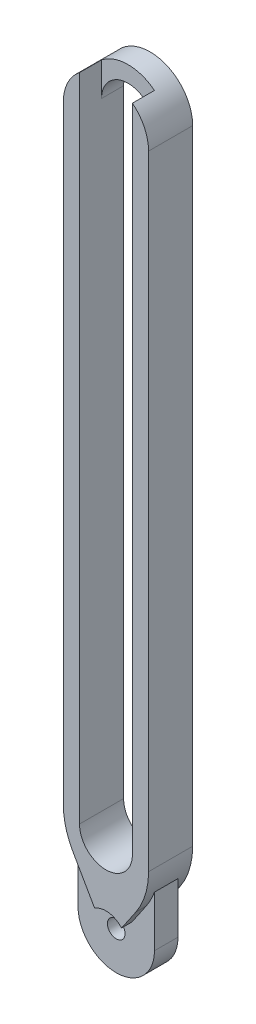
from build123d import *

# Parameters (mm, degrees)
ESTRUSIONE_ESTRUSIONE1_DEPTH = 7.5
ESTRUSIONE_ESTRUSIONE2_DEPTH = 4
TAGLIO_ESTRUSIONE1_DEPTH     = 198.380910943
TAGLIO_ESTRUSIONE2_DEPTH     = 198.380910943
RACCORDO1_R                  = 25
TAGLIO_ESTRUSIONE3_DEPTH     = 7.5
TAGLIO_ESTRUSIONE4_DEPTH     = 7.5
SCHIZZO6_R                   = 3
TAGLIO_ESTRUSIONE5_DEPTH     = 198.380910943


with BuildPart() as part:
    # Schizzo1 → Estrusione-Estrusione1 (new, symmetric)
    with BuildSketch(Plane.XY):
        with BuildLine():
            Line((14.5, 182.011383906), (14.5, -37.988616094))
            ThreePointArc((14.5, -37.988616094), (0, -52.488616094), (-14.5, -37.988616094))
            Line((-14.5, -37.988616094), (-14.5, 182.011383906))
            ThreePointArc((-14.5, 182.011383906), (0, 196.511383906), (14.5, 182.011383906))
        make_face()
    extrude(amount=ESTRUSIONE_ESTRUSIONE1_DEPTH, both=True)

    # Schizzo2 → Estrusione-Estrusione2 (add, symmetric)
    with BuildSketch(Plane.XY):
        with BuildLine():
            Line((13, -40.066616094), (13, -56.066616094))
            ThreePointArc((13, -56.066616094), (0, -69.066616094), (-13, -56.066616094))
            Line((-13, -56.066616094), (-13, -40.066616094))
            ThreePointArc((-13, -40.066616094), (0, -27.066616094), (13, -40.066616094))
        make_face()
    extrude(amount=ESTRUSIONE_ESTRUSIONE2_DEPTH, both=True)

    # Schizzo4 → Taglio-Estrusione1 (cut, through all)
    with BuildSketch(Plane.XY.offset(4)):
        with BuildLine():
            Line((5.29445937, -51.487456784), (14.5, -37.988616094))
            Line((14.5, -37.988616094), (21.494330869, -44.738036439))
            Line((21.494330869, -44.738036439), (5.386515672, -60.537124892))
            ThreePointArc((5.386515672, -60.537124892), (0.071202698, -63.066253954), (-5.29445937, -60.645775404))
            Line((-5.29445937, -60.645775404), (-28.596127717, -39.453615031))
            Line((-28.596127717, -39.453615031), (-14.5, -31.562211214))
            Line((-14.5, -31.562211214), (-3.845832517, -50.217721134))
            ThreePointArc((-3.845832517, -50.217721134), (0.963165144, -49.133196093), (5.29445937, -51.487456784))
        make_face()
    taglio_estrusione1 = extrude(amount=TAGLIO_ESTRUSIONE1_DEPTH, mode=Mode.SUBTRACT)

    # Specchia1: Taglio-Estrusione1 across plane
    add(taglio_estrusione1.mirror(Plane.XY), mode=Mode.SUBTRACT)

    # Schizzo5 → Taglio-Estrusione2 (cut, through all)
    with BuildSketch(Plane.XY.offset(4)):
        Polygon((-13, -44.411232383), (-13, -34.188720036), (-15.056335757, -30.588064032), (-15.056335757, -43.619366988), align=None)
        Polygon((13, -44.411232383), (13, -40.188189356), (17.407959402, -33.724436261), (17.407959402, -44.411232383), align=None)
    extrude(amount=-TAGLIO_ESTRUSIONE2_DEPTH, mode=Mode.SUBTRACT)

    # Raccordo1
    # the kernel refuses this fillet: 25 mm, written as the material it takes off along each edge
    with BuildSketch(Plane(origin=(-14.5, -31.562211214, -24.089497944), x_dir=(0.4959240379913526, -0.8683659070589721, 0), z_dir=(0, 0, 1))) as raccordo1_piece_1_section:
        with BuildLine():
            CenterArc((RACCORDO1_R * 0.26543196711, RACCORDO1_R), RACCORDO1_R, 240.269299078, 29.730700922)
            Line((-RACCORDO1_R * 0.230492070882, RACCORDO1_R * 0.131634092941), (0, 0))
            Line((0, 0), (RACCORDO1_R * 0.26543196711, 0))
        make_face()
    raccordo1_piece_1 = extrude(amount=48.178995889, mode=Mode.PRIVATE)
    raccordo1_piece_1 = split(raccordo1_piece_1, bisect_by=Plane(origin=(-13, -35.788331904, -14.044748972), z_dir=(1, 0, 0)), keep=Keep.TOP, mode=Mode.PRIVATE)
    raccordo1_piece_1 = split(raccordo1_piece_1, bisect_by=Plane(origin=(-12.28179921, -35.788331904, -4), z_dir=(0, 0, -1)), keep=Keep.TOP, mode=Mode.PRIVATE)
    add(raccordo1_piece_1, mode=Mode.SUBTRACT)
    with BuildSketch(Plane(origin=(-14.5, -31.562211214, -24.089497944), x_dir=(0.4959240379913526, -0.8683659070589721, 0), z_dir=(0, 0, 1))) as raccordo1_piece_2_section:
        with BuildLine():
            CenterArc((RACCORDO1_R * 0.26543196711, RACCORDO1_R), RACCORDO1_R, 240.269299078, 29.730700922)
            Line((-RACCORDO1_R * 0.230492070882, RACCORDO1_R * 0.131634092941), (0, 0))
            Line((0, 0), (RACCORDO1_R * 0.26543196711, 0))
        make_face()
    raccordo1_piece_2 = extrude(amount=48.178995889, mode=Mode.PRIVATE)
    raccordo1_piece_2 = split(raccordo1_piece_2, bisect_by=Plane(origin=(-13, -30.370530988, -14.044748972), z_dir=(-1, 0, 0)), keep=Keep.TOP, mode=Mode.PRIVATE)
    raccordo1_piece_2 = split(raccordo1_piece_2, bisect_by=Plane(origin=(-14.266276842, -30.370530988, -4), z_dir=(0, 0, -1)), keep=Keep.TOP, mode=Mode.PRIVATE)
    add(raccordo1_piece_2, mode=Mode.SUBTRACT)
    with BuildSketch(Plane(origin=(-14.5, -31.562211214, -24.089497944), x_dir=(0.4959240379913526, -0.8683659070589721, 0), z_dir=(0, 0, 1))) as raccordo1_piece_3_section:
        with BuildLine():
            CenterArc((RACCORDO1_R * 0.26543196711, RACCORDO1_R), RACCORDO1_R, 240.269299078, 29.730700922)
            Line((-RACCORDO1_R * 0.230492070882, RACCORDO1_R * 0.131634092941), (0, 0))
            Line((0, 0), (RACCORDO1_R * 0.26543196711, 0))
        make_face()
    raccordo1_piece_3 = extrude(amount=48.178995889, mode=Mode.PRIVATE)
    raccordo1_piece_3 = split(raccordo1_piece_3, bisect_by=Plane(origin=(-14.266276842, -30.370530988, 4), z_dir=(0, 0, -1)), keep=Keep.TOP, mode=Mode.PRIVATE)
    raccordo1_piece_3 = split(raccordo1_piece_3, bisect_by=Plane(origin=(-13, -30.370530988, 0), z_dir=(-1, 0, 0)), keep=Keep.TOP, mode=Mode.PRIVATE)
    raccordo1_piece_3 = split(raccordo1_piece_3, bisect_by=Plane(origin=(-14.266276842, -30.370530988, -4), z_dir=(0, 0, 1)), keep=Keep.TOP, mode=Mode.PRIVATE)
    add(raccordo1_piece_3, mode=Mode.SUBTRACT)
    with BuildSketch(Plane(origin=(-14.5, -31.562211214, -24.089497944), x_dir=(0.4959240379913526, -0.8683659070589721, 0), z_dir=(0, 0, 1))) as raccordo1_piece_4_section:
        with BuildLine():
            CenterArc((RACCORDO1_R * 0.26543196711, RACCORDO1_R), RACCORDO1_R, 240.269299078, 29.730700922)
            Line((-RACCORDO1_R * 0.230492070882, RACCORDO1_R * 0.131634092941), (0, 0))
            Line((0, 0), (RACCORDO1_R * 0.26543196711, 0))
        make_face()
    raccordo1_piece_4 = extrude(amount=48.178995889, mode=Mode.PRIVATE)
    raccordo1_piece_4 = split(raccordo1_piece_4, bisect_by=Plane(origin=(-12.28179921, -35.788331904, 4), z_dir=(0, 0, 1)), keep=Keep.TOP, mode=Mode.PRIVATE)
    raccordo1_piece_4 = split(raccordo1_piece_4, bisect_by=Plane(origin=(-13, -35.788331904, 14.044748972), z_dir=(1, 0, 0)), keep=Keep.TOP, mode=Mode.PRIVATE)
    add(raccordo1_piece_4, mode=Mode.SUBTRACT)
    with BuildSketch(Plane(origin=(-14.5, -31.562211214, -24.089497944), x_dir=(0.4959240379913526, -0.8683659070589721, 0), z_dir=(0, 0, 1))) as raccordo1_piece_5_section:
        with BuildLine():
            CenterArc((RACCORDO1_R * 0.26543196711, RACCORDO1_R), RACCORDO1_R, 240.269299078, 29.730700922)
            Line((-RACCORDO1_R * 0.230492070882, RACCORDO1_R * 0.131634092941), (0, 0))
            Line((0, 0), (RACCORDO1_R * 0.26543196711, 0))
        make_face()
    raccordo1_piece_5 = extrude(amount=48.178995889, mode=Mode.PRIVATE)
    raccordo1_piece_5 = split(raccordo1_piece_5, bisect_by=Plane(origin=(-14.266276842, -30.370530988, 4), z_dir=(0, 0, 1)), keep=Keep.TOP, mode=Mode.PRIVATE)
    raccordo1_piece_5 = split(raccordo1_piece_5, bisect_by=Plane(origin=(-13, -30.370530988, 14.044748972), z_dir=(-1, 0, 0)), keep=Keep.TOP, mode=Mode.PRIVATE)
    add(raccordo1_piece_5, mode=Mode.SUBTRACT)
    with BuildSketch(Plane(origin=(14.5, -37.988616094, 26.782481556), x_dir=(0, 1, 0), z_dir=(0, 0, -1))) as raccordo1_piece_6_section:
        with BuildLine():
            CenterArc((RACCORDO1_R * 0.308519704891, -RACCORDO1_R), RACCORDO1_R, 90, 34.292050498)
            Line((-RACCORDO1_R * 0.254891721625, -RACCORDO1_R * 0.173823527041), (0, 0))
            Line((0, 0), (RACCORDO1_R * 0.308519704891, 0))
        make_face()
    raccordo1_piece_6 = extrude(amount=53.564963111, mode=Mode.PRIVATE)
    raccordo1_piece_6 = split(raccordo1_piece_6, bisect_by=Plane(origin=(14.242102238, -36.251699178, 4), z_dir=(0, 0, 1)), keep=Keep.TOP, mode=Mode.PRIVATE)
    raccordo1_piece_6 = split(raccordo1_piece_6, bisect_by=Plane(origin=(13, -36.251699178, 15.391240778), z_dir=(1, 0, 0)), keep=Keep.TOP, mode=Mode.PRIVATE)
    add(raccordo1_piece_6, mode=Mode.SUBTRACT)
    with BuildSketch(Plane(origin=(14.5, -37.988616094, 26.782481556), x_dir=(0, 1, 0), z_dir=(0, 0, -1))) as raccordo1_piece_7_section:
        with BuildLine():
            CenterArc((RACCORDO1_R * 0.308519704891, -RACCORDO1_R), RACCORDO1_R, 90, 34.292050498)
            Line((-RACCORDO1_R * 0.254891721625, -RACCORDO1_R * 0.173823527041), (0, 0))
            Line((0, 0), (RACCORDO1_R * 0.308519704891, 0))
        make_face()
    raccordo1_piece_7 = extrude(amount=53.564963111, mode=Mode.PRIVATE)
    raccordo1_piece_7 = split(raccordo1_piece_7, bisect_by=Plane(origin=(11.895384145, -41.966992208, 4), z_dir=(0, 0, 1)), keep=Keep.TOP, mode=Mode.PRIVATE)
    raccordo1_piece_7 = split(raccordo1_piece_7, bisect_by=Plane(origin=(13, -41.966992208, 15.391240778), z_dir=(-1, 0, 0)), keep=Keep.TOP, mode=Mode.PRIVATE)
    add(raccordo1_piece_7, mode=Mode.SUBTRACT)
    with BuildSketch(Plane(origin=(14.5, -37.988616094, 26.782481556), x_dir=(0, 1, 0), z_dir=(0, 0, -1))) as raccordo1_piece_8_section:
        with BuildLine():
            CenterArc((RACCORDO1_R * 0.308519704891, -RACCORDO1_R), RACCORDO1_R, 90, 34.292050498)
            Line((-RACCORDO1_R * 0.254891721625, -RACCORDO1_R * 0.173823527041), (0, 0))
            Line((0, 0), (RACCORDO1_R * 0.308519704891, 0))
        make_face()
    raccordo1_piece_8 = extrude(amount=53.564963111, mode=Mode.PRIVATE)
    raccordo1_piece_8 = split(raccordo1_piece_8, bisect_by=Plane(origin=(14.242102238, -36.251699178, 4), z_dir=(0, 0, -1)), keep=Keep.TOP, mode=Mode.PRIVATE)
    raccordo1_piece_8 = split(raccordo1_piece_8, bisect_by=Plane(origin=(14.242102238, -36.251699178, -4), z_dir=(0, 0, 1)), keep=Keep.TOP, mode=Mode.PRIVATE)
    raccordo1_piece_8 = split(raccordo1_piece_8, bisect_by=Plane(origin=(13, -36.251699178, 0), z_dir=(1, 0, 0)), keep=Keep.TOP, mode=Mode.PRIVATE)
    add(raccordo1_piece_8, mode=Mode.SUBTRACT)
    with BuildSketch(Plane(origin=(14.5, -37.988616094, 26.782481556), x_dir=(0, 1, 0), z_dir=(0, 0, -1))) as raccordo1_piece_9_section:
        with BuildLine():
            CenterArc((RACCORDO1_R * 0.308519704891, -RACCORDO1_R), RACCORDO1_R, 90, 34.292050498)
            Line((-RACCORDO1_R * 0.254891721625, -RACCORDO1_R * 0.173823527041), (0, 0))
            Line((0, 0), (RACCORDO1_R * 0.308519704891, 0))
        make_face()
    raccordo1_piece_9 = extrude(amount=53.564963111, mode=Mode.PRIVATE)
    raccordo1_piece_9 = split(raccordo1_piece_9, bisect_by=Plane(origin=(14.242102238, -36.251699178, -4), z_dir=(0, 0, -1)), keep=Keep.TOP, mode=Mode.PRIVATE)
    raccordo1_piece_9 = split(raccordo1_piece_9, bisect_by=Plane(origin=(13, -36.251699178, -15.391240778), z_dir=(1, 0, 0)), keep=Keep.TOP, mode=Mode.PRIVATE)
    add(raccordo1_piece_9, mode=Mode.SUBTRACT)
    with BuildSketch(Plane(origin=(14.5, -37.988616094, 26.782481556), x_dir=(0, 1, 0), z_dir=(0, 0, -1))) as raccordo1_piece_10_section:
        with BuildLine():
            CenterArc((RACCORDO1_R * 0.308519704891, -RACCORDO1_R), RACCORDO1_R, 90, 34.292050498)
            Line((-RACCORDO1_R * 0.254891721625, -RACCORDO1_R * 0.173823527041), (0, 0))
            Line((0, 0), (RACCORDO1_R * 0.308519704891, 0))
        make_face()
    raccordo1_piece_10 = extrude(amount=53.564963111, mode=Mode.PRIVATE)
    raccordo1_piece_10 = split(raccordo1_piece_10, bisect_by=Plane(origin=(11.895384145, -41.966992208, -4), z_dir=(0, 0, -1)), keep=Keep.TOP, mode=Mode.PRIVATE)
    raccordo1_piece_10 = split(raccordo1_piece_10, bisect_by=Plane(origin=(13, -41.966992208, -15.391240778), z_dir=(-1, 0, 0)), keep=Keep.TOP, mode=Mode.PRIVATE)
    add(raccordo1_piece_10, mode=Mode.SUBTRACT)

    # Schizzo8 → Taglio-Estrusione3 (cut, symmetric)
    with BuildSketch(Plane.XY):
        with BuildLine():
            Line((9, 182.011383906), (9, -27.988616094))
            ThreePointArc((9, -27.988616094), (0, -36.988616094), (-9, -27.988616094))
            Line((-9, -27.988616094), (-9, 182.011383906))
            ThreePointArc((-9, 182.011383906), (0, 191.011383906), (9, 182.011383906))
        make_face()
    extrude(amount=TAGLIO_ESTRUSIONE3_DEPTH, both=True, mode=Mode.SUBTRACT)

    # Schizzo9 → Taglio-Estrusione4 (cut)
    with BuildSketch(Plane.XY.offset(7.5)):
        with BuildLine():
            Line((-9, 182.011383906), (-9, 202.011383906))
            ThreePointArc((-9, 202.011383906), (0, 211.011383906), (9, 202.011383906))
            Line((9, 202.011383906), (9, 182.011383906))
            ThreePointArc((9, 182.011383906), (0, 173.011383906), (-9, 182.011383906))
        make_face()
    extrude(amount=-TAGLIO_ESTRUSIONE4_DEPTH, mode=Mode.SUBTRACT)

    # Schizzo6 → Taglio-Estrusione5 (cut, through all)
    with BuildSketch(Plane.XY.offset(4)):
        with Locations((0, -56.066616094)):
            Circle(SCHIZZO6_R)
    extrude(amount=-TAGLIO_ESTRUSIONE5_DEPTH, mode=Mode.SUBTRACT)


solid = part.part
